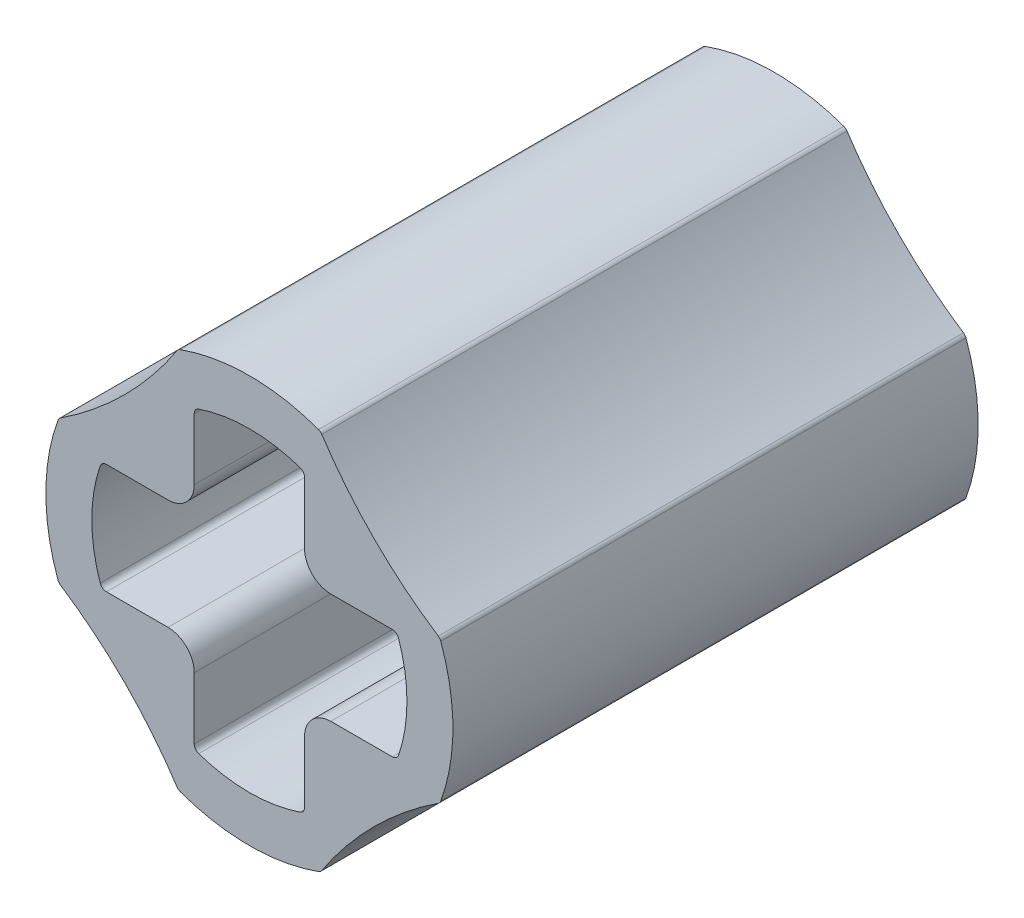
from build123d import *

# Parameters (mm, degrees)
BOSS_EXTRUDE1_DEPTH = 8
CUT_EXTRUDE1_DEPTH  = 8
FILLET1_R           = 0.4
FILLET2_R           = 0.4
FILLET3_R           = 0.4
FILLET4_R           = 0.4
FILLET5_R           = 6.2
FILLET6_R           = 6.2
FILLET7_R           = 6.2
FILLET8_R           = 6.2
FILLET9_R           = 0.1
FILLET10_R          = 0.1
FILLET11_R          = 0.1
FILLET12_R          = 0.1
FILLET13_R          = 0.1
FILLET14_R          = 0.1
FILLET15_R          = 0.1
FILLET16_R          = 0.1
FILLET17_R          = 0.1
FILLET18_R          = 0.1
FILLET19_R          = 0.1
FILLET20_R          = 0.1
FILLET21_R          = 0.1
FILLET22_R          = 0.1
FILLET23_R          = 0.1
FILLET24_R          = 0.1


with BuildPart() as part:
    # Sketch1 → Boss-Extrude1 (new body)
    with BuildSketch(Plane.XY):
        with BuildLine():
            Line((-1.085, -1.085), (-1.085, -2.903924069))
            ThreePointArc((-1.085, -2.903924069), (0, -3.1), (1.085, -2.903924069))
            Line((1.085, -2.903924069), (1.085, -1.085))
            Line((1.085, -1.085), (2.903924069, -1.085))
            ThreePointArc((2.903924069, -1.085), (3.1, 0), (2.903924069, 1.085))
            Line((2.903924069, 1.085), (1.085, 1.085))
            Line((1.085, 1.085), (1.085, 2.903924069))
            ThreePointArc((1.085, 2.903924069), (0, 3.1), (-1.085, 2.903924069))
            Line((-1.085, 2.903924069), (-1.085, 1.085))
            Line((-1.085, 1.085), (-2.903924069, 1.085))
            ThreePointArc((-2.903924069, 1.085), (-3.1, 0), (-2.903924069, -1.085))
            Line((-2.903924069, -1.085), (-1.085, -1.085))
        make_face()
    extrude(amount=BOSS_EXTRUDE1_DEPTH)

    # Sketch2 → Cut-Extrude1 (cut)
    with BuildSketch(Plane.XY):
        with BuildLine():
            Line((0.84, -0.84), (2.248199279, -0.84))
            ThreePointArc((2.248199279, -0.84), (2.4, 0), (2.248199279, 0.84))
            Line((2.248199279, 0.84), (0.84, 0.84))
            Line((0.84, 0.84), (0.84, 2.248199279))
            ThreePointArc((0.84, 2.248199279), (0, 2.4), (-0.84, 2.248199279))
            Line((-0.84, 2.248199279), (-0.84, 0.84))
            Line((-0.84, 0.84), (-2.248199279, 0.84))
            ThreePointArc((-2.248199279, 0.84), (-2.4, 0), (-2.248199279, -0.84))
            Line((-2.248199279, -0.84), (-0.84, -0.84))
            Line((-0.84, -0.84), (-0.84, -2.248199279))
            ThreePointArc((-0.84, -2.248199279), (0, -2.4), (0.84, -2.248199279))
            Line((0.84, -2.248199279), (0.84, -0.84))
        make_face()
    extrude(amount=CUT_EXTRUDE1_DEPTH, mode=Mode.SUBTRACT)

    # Fillet1
    fillet1_edges = [part.edges().sort_by_distance(p)[0] for p in [
        (-0.84, 0.84, 4),
    ]]
    fillet(fillet1_edges, radius=FILLET1_R)

    # Fillet2
    fillet2_edges = [part.edges().sort_by_distance(p)[0] for p in [
        (0.84, 0.84, 4),
    ]]
    fillet(fillet2_edges, radius=FILLET2_R)

    # Fillet3
    fillet3_edges = [part.edges().sort_by_distance(p)[0] for p in [
        (0.84, -0.84, 4),
    ]]
    fillet(fillet3_edges, radius=FILLET3_R)

    # Fillet4
    fillet4_edges = [part.edges().sort_by_distance(p)[0] for p in [
        (-0.84, -0.84, 4),
    ]]
    fillet(fillet4_edges, radius=FILLET4_R)

    # Fillet5
    # the kernel refuses this fillet: 6.2 mm, written as the material it adds along each edge
    with BuildSketch(Plane(origin=(-1.085, 1.085, 0), x_dir=(-1, 0, 0), z_dir=(0, 0, 1))) as fillet5_piece_1:
        with BuildLine():
            CenterArc((5.198154004, -5.198154004), FILLET5_R, 123.027198012, 23.945603977)
            Line((0, -1.818924069), (0, 0))
            Line((0, 0), (1.818924069, 0))
        make_face()
    extrude(amount=8)

    # Fillet6
    # the kernel refuses this fillet: 6.2 mm, written as the material it adds along each edge
    with BuildSketch(Plane(origin=(-1.085, -1.085, 0), x_dir=(-1, 0, 0), z_dir=(0, 0, 1))) as fillet6_piece_1:
        with BuildLine():
            CenterArc((5.198154004, 5.198154004), FILLET6_R, 213.027198012, 23.945603977)
            Line((0, 1.818924069), (0, 0))
            Line((0, 0), (1.818924069, 0))
        make_face()
    extrude(amount=8)

    # Fillet7
    # the kernel refuses this fillet: 6.2 mm, written as the material it adds along each edge
    with BuildSketch(Plane(origin=(1.085, -1.085, 0), x_dir=(0, -1, 0), z_dir=(0, 0, 1))) as fillet7_piece_1:
        with BuildLine():
            CenterArc((5.198154004, 5.198154004), FILLET7_R, 213.027198012, 23.945603977)
            Line((0, 1.818924069), (0, 0))
            Line((0, 0), (1.818924069, 0))
        make_face()
    extrude(amount=8)

    # Fillet8
    # the kernel refuses this fillet: 6.2 mm, written as the material it adds along each edge
    with BuildSketch(Plane(origin=(1.085, 1.085, 0), x_dir=(1, 0, 0), z_dir=(0, 0, 1))) as fillet8_piece_1:
        with BuildLine():
            CenterArc((5.198154004, 5.198154004), FILLET8_R, 213.027198012, 23.945603977)
            Line((0, 1.818924069), (0, 0))
            Line((0, 0), (1.818924069, 0))
        make_face()
    extrude(amount=8)

    # Fillet9
    fillet9_edges = [part.edges().sort_by_distance(p)[0] for p in [
        (0.84, 2.248199279, 4),
    ]]
    fillet(fillet9_edges, radius=FILLET9_R)

    # Fillet10
    fillet10_edges = [part.edges().sort_by_distance(p)[0] for p in [
        (1.085, 2.903924069, 4),
    ]]
    fillet(fillet10_edges, radius=FILLET10_R)

    # Fillet11
    fillet11_edges = [part.edges().sort_by_distance(p)[0] for p in [
        (-1.085, 2.903924069, 4),
    ]]
    fillet(fillet11_edges, radius=FILLET11_R)

    # Fillet12
    fillet12_edges = [part.edges().sort_by_distance(p)[0] for p in [
        (-2.903924069, 1.085, 4),
    ]]
    fillet(fillet12_edges, radius=FILLET12_R)

    # Fillet13
    fillet13_edges = [part.edges().sort_by_distance(p)[0] for p in [
        (-2.903924069, -1.085, 4),
    ]]
    fillet(fillet13_edges, radius=FILLET13_R)

    # Fillet14
    fillet14_edges = [part.edges().sort_by_distance(p)[0] for p in [
        (-1.085, -2.903924069, 4),
    ]]
    fillet(fillet14_edges, radius=FILLET14_R)

    # Fillet15
    fillet15_edges = [part.edges().sort_by_distance(p)[0] for p in [
        (1.085, -2.903924069, 4),
    ]]
    fillet(fillet15_edges, radius=FILLET15_R)

    # Fillet16
    fillet16_edges = [part.edges().sort_by_distance(p)[0] for p in [
        (2.903924069, -1.085, 4),
    ]]
    fillet(fillet16_edges, radius=FILLET16_R)

    # Fillet17
    fillet17_edges = [part.edges().sort_by_distance(p)[0] for p in [
        (2.903924069, 1.085, 4),
    ]]
    fillet(fillet17_edges, radius=FILLET17_R)

    # Fillet18
    fillet18_edges = [part.edges().sort_by_distance(p)[0] for p in [
        (0.84, -2.248199279, 4),
    ]]
    fillet(fillet18_edges, radius=FILLET18_R)

    # Fillet19
    fillet19_edges = [part.edges().sort_by_distance(p)[0] for p in [
        (-0.84, -2.248199279, 4),
    ]]
    fillet(fillet19_edges, radius=FILLET19_R)

    # Fillet20
    fillet20_edges = [part.edges().sort_by_distance(p)[0] for p in [
        (-2.248199279, 0.84, 4),
    ]]
    fillet(fillet20_edges, radius=FILLET20_R)

    # Fillet21
    fillet21_edges = [part.edges().sort_by_distance(p)[0] for p in [
        (-2.248199279, -0.84, 4),
    ]]
    fillet(fillet21_edges, radius=FILLET21_R)

    # Fillet22
    fillet22_edges = [part.edges().sort_by_distance(p)[0] for p in [
        (-0.84, 2.248199279, 4),
    ]]
    fillet(fillet22_edges, radius=FILLET22_R)

    # Fillet23
    fillet23_edges = [part.edges().sort_by_distance(p)[0] for p in [
        (2.248199279, -0.84, 4),
    ]]
    fillet(fillet23_edges, radius=FILLET23_R)

    # Fillet24
    fillet24_edges = [part.edges().sort_by_distance(p)[0] for p in [
        (2.248199279, 0.84, 4),
    ]]
    fillet(fillet24_edges, radius=FILLET24_R)


solid = part.part
